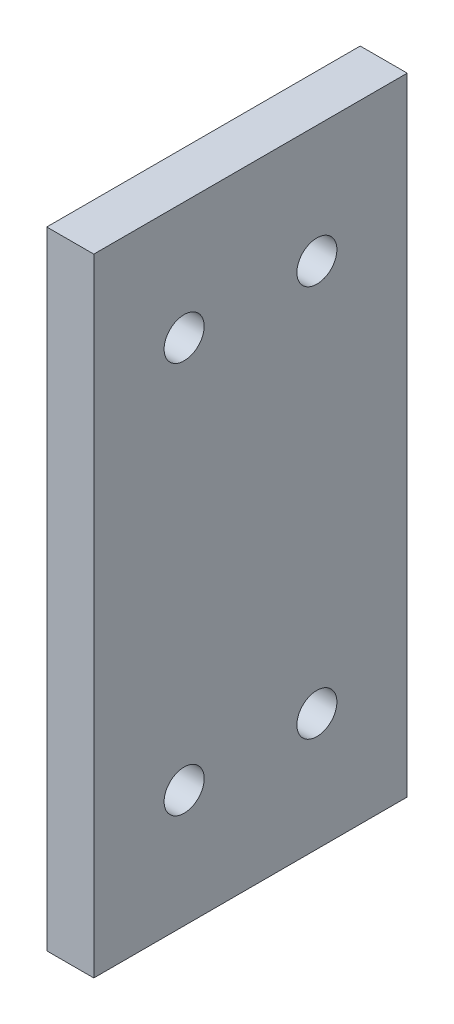
from build123d import *

# Parameters (mm, degrees)
SKETCH1_W           = 80
SKETCH1_H           = 40
BOSS_EXTRUDE2_DEPTH = 6
CUT_EXTRUDE3_REACH  = 47.122
SKETCH1_3_R         = 2.555


with BuildPart() as part:
    # Sketch1 → Boss-Extrude2 (new body)
    with BuildSketch(Plane.YZ):
        Rectangle(SKETCH1_W, SKETCH1_H)
    extrude(amount=BOSS_EXTRUDE2_DEPTH)

    # Sketch1<3> → Cut-Extrude3 (cut, up to next)
    with BuildSketch(Plane.YZ, mode=Mode.PRIVATE) as cut_extrude3_sk1:
        with Locations((-25, 8.47)):
            Circle(SKETCH1_3_R)
    cut_extrude3_tool1 = extrude(cut_extrude3_sk1.sketch, amount=CUT_EXTRUDE3_REACH, mode=Mode.PRIVATE) & part.part
    # Sketch1<3> → Cut-Extrude3 (cut, up to next)
    with BuildSketch(Plane.YZ, mode=Mode.PRIVATE) as cut_extrude3_sk2:
        with Locations((-25, -8.47)):
            Circle(SKETCH1_3_R)
    cut_extrude3_tool2 = extrude(cut_extrude3_sk2.sketch, amount=CUT_EXTRUDE3_REACH, mode=Mode.PRIVATE) & part.part
    # Sketch1<3> → Cut-Extrude3 (cut, up to next)
    with BuildSketch(Plane.YZ, mode=Mode.PRIVATE) as cut_extrude3_sk3:
        with Locations((25, -8.47)):
            Circle(SKETCH1_3_R)
    cut_extrude3_tool3 = extrude(cut_extrude3_sk3.sketch, amount=CUT_EXTRUDE3_REACH, mode=Mode.PRIVATE) & part.part
    # Sketch1<3> → Cut-Extrude3 (cut, up to next)
    with BuildSketch(Plane.YZ, mode=Mode.PRIVATE) as cut_extrude3_sk4:
        with Locations((25, 8.47)):
            Circle(SKETCH1_3_R)
    cut_extrude3_tool4 = extrude(cut_extrude3_sk4.sketch, amount=CUT_EXTRUDE3_REACH, mode=Mode.PRIVATE) & part.part
    add(cut_extrude3_tool1.solids().sort_by_distance((0, -25, 8.47))[0], mode=Mode.SUBTRACT)
    add(cut_extrude3_tool2.solids().sort_by_distance((0, -25, -8.47))[0], mode=Mode.SUBTRACT)
    add(cut_extrude3_tool3.solids().sort_by_distance((0, 25, -8.47))[0], mode=Mode.SUBTRACT)
    add(cut_extrude3_tool4.solids().sort_by_distance((0, 25, 8.47))[0], mode=Mode.SUBTRACT)


solid = part.part
